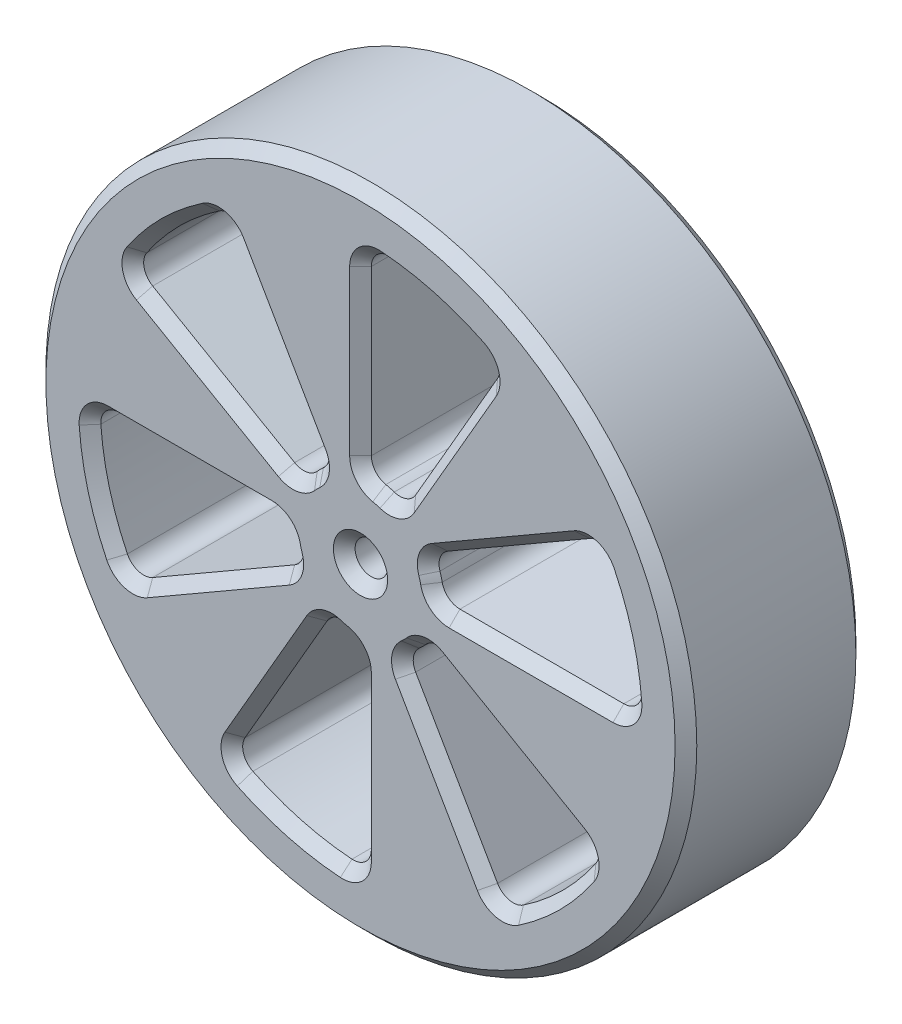
from build123d import *

# Parameters (mm, degrees)
SKETCH1_R           = 90
BOSS_EXTRUDE1_DEPTH = 50
CUT_EXTRUDE1_DEPTH  = 137.747943312
CIRPATTERN1_COUNT   = 6
FILLET1_R           = 5
SKETCH3_R           = 4.5
CUT_EXTRUDE2_DEPTH  = 137.747943312
CHAMFER1_SIZE       = 3


with BuildPart() as part:
    # Sketch1 → Boss-Extrude1 (new body)
    with BuildSketch(Plane.XY):
        Circle(SKETCH1_R)
    extrude(amount=BOSS_EXTRUDE1_DEPTH)

    # Sketch2 → Cut-Extrude1 (cut, through all)
    with BuildSketch(Plane.XY.offset(50)):
        with BuildLine():
            Line((0, 75), (0, 20))
            ThreePointArc((0, 20), (5.176380902, 19.318516526), (10, 17.320508076))
            Line((10, 17.320508076), (37.5, 64.951905284))
            ThreePointArc((37.5, 64.951905284), (19.411428383, 72.444436972), (0, 75))
        make_face()
    cut_extrude1 = extrude(amount=-CUT_EXTRUDE1_DEPTH, mode=Mode.SUBTRACT)

    # CirPattern1: Cut-Extrude1 ×6 about axis
    cirpattern1_axis = Axis((0, 0, 50), (0, 0, -1))
    for i in range(1, CIRPATTERN1_COUNT):
        add(cut_extrude1.rotate(cirpattern1_axis, i * 360 / CIRPATTERN1_COUNT), mode=Mode.SUBTRACT)

    # Fillet1
    fillet1_edges = [part.edges().sort_by_distance(p)[0] for p in [
        (0, 75, 25),
        (37.5, 64.951905284, 25),
        (10, 17.320508076, 25),
        (-17.320508076, 10, 25),
        (-64.951905284, 37.5, 25),
        (-37.5, 64.951905284, 25),
        (-10, 17.320508076, 25),
        (0, -20, 25),
        (0, -75, 25),
        (-37.5, -64.951905284, 25),
        (-10, -17.320508076, 25),
        (-17.320508076, -10, 25),
        (-64.951905284, -37.5, 25),
        (-75, 0, 25),
        (-20, 0, 25),
        (17.320508076, -10, 25),
        (64.951905284, -37.5, 25),
        (37.5, -64.951905284, 25),
        (10, -17.320508076, 25),
        (17.320508076, 10, 25),
        (64.951905284, 37.5, 25),
        (75, 0, 25),
        (20, 0, 25),
        (0, 20, 25),
    ]]
    fillet(fillet1_edges, radius=FILLET1_R)

    # Sketch3 → Cut-Extrude2 (cut, through all)
    with BuildSketch(Plane.XY.offset(50)):
        Circle(SKETCH3_R)
    extrude(amount=-CUT_EXTRUDE2_DEPTH, mode=Mode.SUBTRACT)

    # Chamfer1
    chamfer1_edges = [part.edges().sort_by_distance(p)[0] for p in [
        (-90, 0, 50),
        (35.360769949, 64.432798708, 50),
        (19.411428383, 72.444436972, 50),
        (1.593074281, 73.480825492, 50),
        (0, 47.158048823, 50),
        (1.127016654, 21.332619768, 50),
        (5.176380902, 19.318516526, 50),
        (9.690284831, 19.038098975, 50),
        (23.579024412, 40.840068274, 50),
        (-38.120055543, 62.839724427, 50),
        (-53.033008589, 53.033008589, 50),
        (-62.839724427, 38.120055543, 50),
        (-40.840068274, 23.579024412, 50),
        (-17.911082321, 11.642334937, 50),
        (-14.142135624, 14.142135624, 50),
        (-11.642334937, 17.911082321, 50),
        (-23.579024412, 40.840068274, 50),
        (-35.360769949, -64.432798708, 50),
        (-19.411428383, -72.444436972, 50),
        (-1.593074281, -73.480825492, 50),
        (0, -47.158048823, 50),
        (-1.127016654, -21.332619768, 50),
        (-5.176380902, -19.318516526, 50),
        (-9.690284831, -19.038098975, 50),
        (-23.579024412, -40.840068274, 50),
        (-73.480825492, -1.593074281, 50),
        (-72.444436972, -19.411428383, 50),
        (-64.432798708, -35.360769949, 50),
        (-40.840068274, -23.579024412, 50),
        (-19.038098975, -9.690284831, 50),
        (-19.318516526, -5.176380902, 50),
        (-21.332619768, -1.127016654, 50),
        (-47.158048823, 0, 50),
        (38.120055543, -62.839724427, 50),
        (53.033008589, -53.033008589, 50),
        (62.839724427, -38.120055543, 50),
        (40.840068274, -23.579024412, 50),
        (17.911082321, -11.642334937, 50),
        (14.142135624, -14.142135624, 50),
        (11.642334937, -17.911082321, 50),
        (23.579024412, -40.840068274, 50),
        (73.480825492, 1.593074281, 50),
        (72.444436972, 19.411428383, 50),
        (64.432798708, 35.360769949, 50),
        (40.840068274, 23.579024412, 50),
        (19.038098975, 9.690284831, 50),
        (19.318516526, 5.176380902, 50),
        (21.332619768, 1.127016654, 50),
        (47.158048823, 0, 50),
        (-4.5, 0, 50),
        (-90, 0, 0),
        (1.127016654, 21.332619768, 0),
        (0, 47.158048823, 0),
        (1.593074281, 73.480825492, 0),
        (19.411428383, 72.444436972, 0),
        (35.360769949, 64.432798708, 0),
        (23.579024412, 40.840068274, 0),
        (9.690284831, 19.038098975, 0),
        (5.176380902, 19.318516526, 0),
        (-17.911082321, 11.642334937, 0),
        (-40.840068274, 23.579024412, 0),
        (-62.839724427, 38.120055543, 0),
        (-53.033008589, 53.033008589, 0),
        (-38.120055543, 62.839724427, 0),
        (-23.579024412, 40.840068274, 0),
        (-11.642334937, 17.911082321, 0),
        (-14.142135624, 14.142135624, 0),
        (-1.127016654, -21.332619768, 0),
        (0, -47.158048823, 0),
        (-1.593074281, -73.480825492, 0),
        (-19.411428383, -72.444436972, 0),
        (-35.360769949, -64.432798708, 0),
        (-23.579024412, -40.840068274, 0),
        (-9.690284831, -19.038098975, 0),
        (-5.176380902, -19.318516526, 0),
        (-19.038098975, -9.690284831, 0),
        (-40.840068274, -23.579024412, 0),
        (-64.432798708, -35.360769949, 0),
        (-72.444436972, -19.411428383, 0),
        (-73.480825492, -1.593074281, 0),
        (-47.158048823, 0, 0),
        (-21.332619768, -1.127016654, 0),
        (-19.318516526, -5.176380902, 0),
        (17.911082321, -11.642334937, 0),
        (40.840068274, -23.579024412, 0),
        (62.839724427, -38.120055543, 0),
        (53.033008589, -53.033008589, 0),
        (38.120055543, -62.839724427, 0),
        (23.579024412, -40.840068274, 0),
        (11.642334937, -17.911082321, 0),
        (14.142135624, -14.142135624, 0),
        (19.038098975, 9.690284831, 0),
        (40.840068274, 23.579024412, 0),
        (64.432798708, 35.360769949, 0),
        (72.444436972, 19.411428383, 0),
        (73.480825492, 1.593074281, 0),
        (47.158048823, 0, 0),
        (21.332619768, 1.127016654, 0),
        (19.318516526, 5.176380902, 0),
        (-4.5, 0, 0),
    ]]
    chamfer(chamfer1_edges, length=CHAMFER1_SIZE)


solid = part.part
